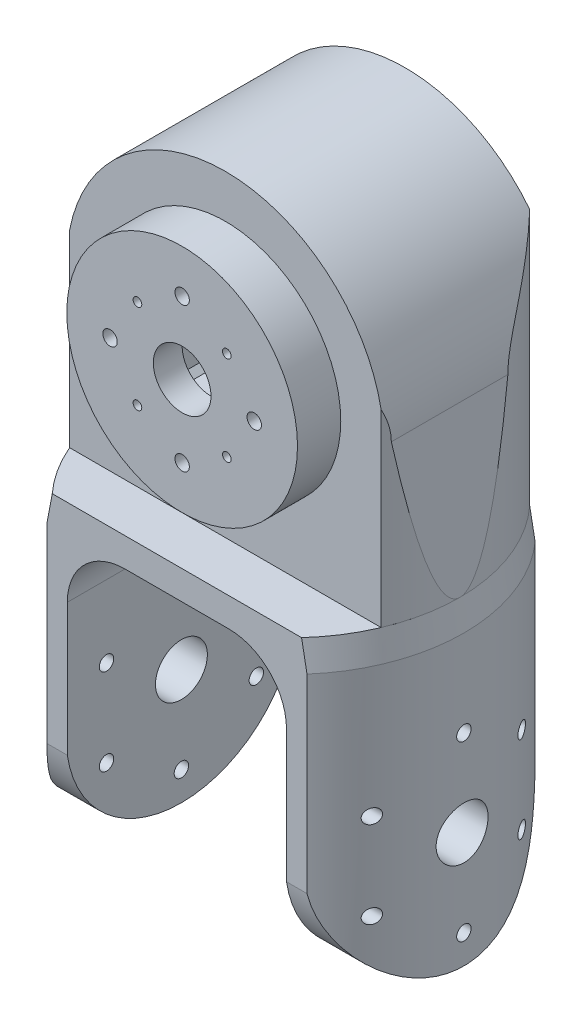
from build123d import *

# Parameters (mm, degrees)
SKETCH1_R                = 60
BOSS_EXTRUDE2_DEPTH      = 40
BOSS_EXTRUDE2_TAPER      = 8
SKETCH3_R                = 60
BOSS_EXTRUDE4_DEPTH      = 100
CUT_EXTRUDE2_START       = -100
CUT_EXTRUDE2_DEPTH       = 100
FILLET1_R                = 20
CUT_EXTRUDE3_DEPTH       = 200
CUT_EXTRUDE3_DEPTH_BACK  = 80
CUT_EXTRUDE5_DEPTH       = 153.328592364
CUT_EXTRUDE5_DEPTH_BACK  = 153.328592364
SKETCH9_R                = 2.5
SKETCH9_R_2              = 9
SKETCH10_R               = 60
CUT_EXTRUDE7_DEPTH       = 30
SKETCH12_R               = 55
BOSS_EXTRUDE5_DEPTH      = 55
SKETCH13_R               = 82.5
SKETCH13_R_2             = 58.594591653
CUT_EXTRUDE9_DEPTH       = 110
CUT_EXTRUDE10_DEPTH      = 110
SKETCH15_R               = 40
BOSS_EXTRUDE6_DEPTH      = 15
SKETCH16_R               = 1.5
SKETCH16_R_2             = 10
CUT_EXTRUDE11_DEPTH      = 166.994117465
CUT_EXTRUDE12_DEPTH      = 82.744805363
SKETCH18_R               = 2.5
CUT_EXTRUDE13_DEPTH      = 166.994117465
CUT_EXTRUDE14_DEPTH      = 147.969384737
CUT_EXTRUDE14_DEPTH_BACK = 147.969384737
SKETCH19_W               = 93.681912075
SKETCH19_H               = 24.075037612
SKETCH19_W_2             = 105.550586335
SKETCH19_H_2             = 26.083582487
SKETCH20_W               = 20
SKETCH20_H               = 8
CUT_EXTRUDE15_DEPTH      = 20


with BuildPart() as part:
    # Sketch1 → Boss-Extrude2 (new body)
    with BuildSketch(Plane(origin=(0, 0, 0), x_dir=(1, 0, 0), z_dir=(0, 1, 0))):
        Circle(SKETCH1_R)
    extrude(amount=BOSS_EXTRUDE2_DEPTH, taper=BOSS_EXTRUDE2_TAPER)

    # Sketch3 → Boss-Extrude4 (add)
    with BuildSketch(Plane.XZ):
        with Locations(Location((0, 0, 0), (0, 0, 90))):
            Circle(SKETCH3_R)
    extrude(amount=BOSS_EXTRUDE4_DEPTH)

    # Sketch4 → Cut-Extrude2 (cut)
    with BuildSketch(Plane.XZ.offset(100).offset(CUT_EXTRUDE2_START)):
        with BuildLine():
            Line((38, -46.432747065), (38, 46.432747065))
            ThreePointArc((38, 46.432747065), (0, 60), (-38, 46.432747065))
            Line((-38, 46.432747065), (-38, -46.432747065))
            ThreePointArc((-38, -46.432747065), (0, -60), (38, -46.432747065))
        make_face()
    extrude(amount=CUT_EXTRUDE2_DEPTH, mode=Mode.SUBTRACT)

    # Fillet1
    # the kernel refuses this fillet: 20 mm, written as the material it adds along each edge
    with BuildSketch(Plane(origin=(38, 0, -96.432747065), x_dir=(-1, 0, 0), z_dir=(0, 0, 1))) as fillet1_piece_1_section:
        with BuildLine():
            CenterArc((FILLET1_R, FILLET1_R), FILLET1_R, 180, 90)
            Line((0, FILLET1_R), (0, 0))
            Line((0, 0), (FILLET1_R, 0))
        make_face()
    fillet1_piece_1 = extrude(amount=192.86549413, mode=Mode.PRIVATE)
    fillet1_piece_1 = fillet1_piece_1 & Plane(origin=(0, -4.359340231, 0), x_dir=(0, 0, 1), z_dir=(0, 1, 0)) * Cylinder(60, 466, mode=Mode.PRIVATE)
    add(fillet1_piece_1)
    with BuildSketch(Plane(origin=(-38, 0, 96.432747065), x_dir=(0, -1, 0), z_dir=(0, 0, -1))) as fillet1_piece_2_section:
        with BuildLine():
            CenterArc((FILLET1_R, -FILLET1_R), FILLET1_R, 90, 90)
            Line((0, -FILLET1_R), (0, 0))
            Line((0, 0), (FILLET1_R, 0))
        make_face()
    fillet1_piece_2 = extrude(amount=192.86549413, mode=Mode.PRIVATE)
    fillet1_piece_2 = fillet1_piece_2 & Plane(origin=(0, -4.359340485, 0), x_dir=(0, 0, 1), z_dir=(0, 1, 0)) * Cylinder(60, 466, mode=Mode.PRIVATE)
    add(fillet1_piece_2)

    # Sketch5 → Cut-Extrude3 (cut, two sides: drawn at the far end of the back side and taken through both)
    with BuildSketch(Plane(origin=(-38, 0, 0), x_dir=(0, 0, -1), z_dir=(1, 0, 0)).offset(-CUT_EXTRUDE3_DEPTH_BACK)):
        with BuildLine():
            Line((-39.559315923, -65.921192758), (-46.432747065, -20))
            Line((-46.432747065, -20), (-46.432747065, -100))
            Line((-46.432747065, -100), (0, -100))
            ThreePointArc((0, -100), (-26.107013327, -90.30550866), (-39.559315923, -65.921192758))
        make_face()
        with BuildLine():
            ThreePointArc((39.559315923, -65.921192758), (26.107013327, -90.30550866), (0, -100))
            Line((0, -100), (46.432747065, -100))
            Line((46.432747065, -100), (46.432747065, -20))
            Line((46.432747065, -20), (39.559315923, -65.921192758))
        make_face()
    extrude(amount=CUT_EXTRUDE3_DEPTH + CUT_EXTRUDE3_DEPTH_BACK, mode=Mode.SUBTRACT)

    # Sketch9 → Cut-Extrude5 (cut, two sides: drawn at the far end of the back side and taken through both)
    with BuildSketch(Plane(origin=(-38, 0, 0), x_dir=(0, 0, -1), z_dir=(1, 0, 0)).offset(-CUT_EXTRUDE5_DEPTH_BACK)):
        with Locations((25.980762114, -45)):
            Circle(SKETCH9_R)
        with Locations((25.980762114, -75)):
            Circle(SKETCH9_R)
        with Locations((0, -30)):
            Circle(SKETCH9_R)
        with Locations((0, -90)):
            Circle(SKETCH9_R)
        with Locations((-25.980762114, -45)):
            Circle(SKETCH9_R)
        with Locations((-25.980762114, -75)):
            Circle(SKETCH9_R)
        with Locations((0, -60)):
            Circle(SKETCH9_R_2)
    extrude(amount=CUT_EXTRUDE5_DEPTH + CUT_EXTRUDE5_DEPTH_BACK, mode=Mode.SUBTRACT)

    # Sketch10 → Cut-Extrude7 (cut)
    with BuildSketch(Plane(origin=(0, 40, 0), x_dir=(1, 0, 0), z_dir=(0, 1, 0))):
        Circle(SKETCH10_R)
    extrude(amount=-CUT_EXTRUDE7_DEPTH, mode=Mode.SUBTRACT)


with BuildPart() as body_2:
    # Sketch12 → Boss-Extrude5 (new, symmetric)
    with BuildSketch(Plane.XY):
        with Locations((0, 65)):
            Circle(SKETCH12_R)
        with BuildLine():
            Line((-55, 65), (-58.594591653, 10))
            Line((-58.594591653, 10), (-1.1e-07, 10))
            ThreePointArc((-1.1e-07, 10), (-38.890873004, 26.109127074), (-55, 65))
        make_face()
        with BuildLine():
            ThreePointArc((55, 65), (38.890872926, 26.109126996), (-1.1e-07, 10))
            Line((-1.1e-07, 10), (58.594591653, 10))
            Line((58.594591653, 10), (55, 65))
        make_face()
    extrude(amount=BOSS_EXTRUDE5_DEPTH, both=True)

    # Sketch13 → Cut-Extrude9 (cut)
    with BuildSketch(Plane.XZ.offset(-10)):
        Circle(SKETCH13_R)
        Circle(SKETCH13_R_2, mode=Mode.SUBTRACT)
    extrude(amount=-CUT_EXTRUDE9_DEPTH, mode=Mode.SUBTRACT)

    # Sketch14 → Cut-Extrude10 (cut)
    with BuildSketch(Plane(origin=(0, 10, 0), x_dir=(1, 0, 0), z_dir=(0, 1, 0))):
        with BuildLine():
            ThreePointArc((-54, -22.744805363), (0, -58.594591653), (54, -22.744805363))
            Line((54, -22.744805363), (-54, -22.744805363))
        make_face()
    extrude(amount=CUT_EXTRUDE10_DEPTH, mode=Mode.SUBTRACT)

    # Sketch15 → Boss-Extrude6 (add)
    with BuildSketch(Plane.XY.offset(22.744805363)):
        with Locations((0, 65)):
            Circle(SKETCH15_R)
    extrude(amount=BOSS_EXTRUDE6_DEPTH)

    # Sketch16 → Cut-Extrude11 (cut, through all)
    with BuildSketch(Plane.XY.offset(37.744805363)):
        with Locations((-15.5, 80.5)):
            Circle(SKETCH16_R)
        with Locations((15.5, 80.5)):
            Circle(SKETCH16_R)
        with Locations((15.5, 49.5)):
            Circle(SKETCH16_R)
        with Locations((-15.5, 49.5)):
            Circle(SKETCH16_R)
        with Locations((0, 65)):
            Circle(SKETCH16_R_2)
    extrude(amount=-CUT_EXTRUDE11_DEPTH, mode=Mode.SUBTRACT)

    # Sketch17 → Cut-Extrude12 (cut)
    with BuildSketch(Plane(origin=(0, 0, -55), x_dir=(-1, 0, 0), z_dir=(0, 0, -1))):
        Polygon((-19, 86), (-21, 84), (-21, 46), (-19, 44), (19, 44), (21, 46), (21, 84), (19, 86), align=None)
    extrude(amount=-CUT_EXTRUDE12_DEPTH, mode=Mode.SUBTRACT)

    # Sketch18 → Cut-Extrude13 (cut, through all)
    with BuildSketch(Plane.XY.offset(37.744805363)):
        with Locations((0, 90)):
            Circle(SKETCH18_R)
        with Locations((25, 65)):
            Circle(SKETCH18_R)
        with Locations((0, 40)):
            Circle(SKETCH18_R)
        with Locations((-25, 65)):
            Circle(SKETCH18_R)
    extrude(amount=-CUT_EXTRUDE13_DEPTH, mode=Mode.SUBTRACT)


with BuildPart() as cut_extrude14_tool:
    # Sketch19 → Cut-Extrude14 (new, two sides: drawn at the far end of the back side and taken through both)
    with BuildSketch(Plane.XZ.offset(-CUT_EXTRUDE14_DEPTH_BACK)):
        with Locations((1.729310937, -51.596834729)):
            Rectangle(SKETCH19_W, SKETCH19_H)
        with Locations((7.663648067, 52.601107167)):
            Rectangle(SKETCH19_W_2, SKETCH19_H_2)
    extrude(amount=CUT_EXTRUDE14_DEPTH + CUT_EXTRUDE14_DEPTH_BACK)


with BuildPart() as part_1:
    add(part.part)

    # Cut-Extrude14: cut by cut_extrude14_tool
    add(cut_extrude14_tool.part, mode=Mode.SUBTRACT)


with BuildPart() as body_2_1:
    add(body_2.part)

    # Cut-Extrude14: cut by cut_extrude14_tool
    add(cut_extrude14_tool.part, mode=Mode.SUBTRACT)

    # Sketch20 → Cut-Extrude15 (cut)
    with BuildSketch(Plane(origin=(0, 0, -39.559315923), x_dir=(-1, 0, 0), z_dir=(0, 0, -1))):
        with Locations((0, 40)):
            Rectangle(SKETCH20_W, SKETCH20_H)
    extrude(amount=-CUT_EXTRUDE15_DEPTH, mode=Mode.SUBTRACT)


solid = Compound([part_1.part, body_2_1.part])
